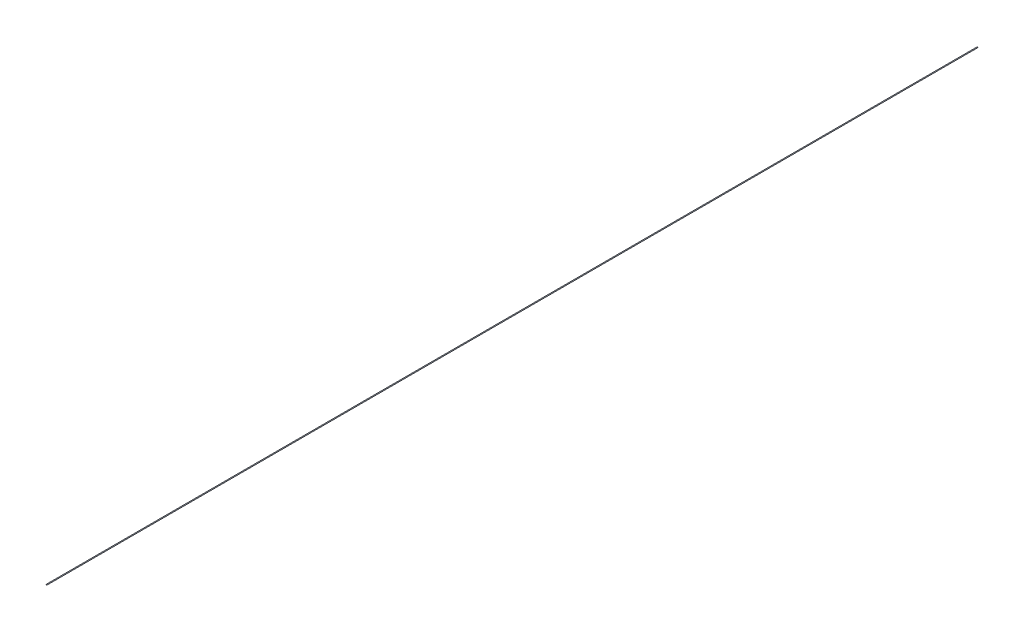
from build123d import *

# Parameters (mm, degrees)
SKETCH1_R      = 3.175
EXTRUDE1_DEPTH = 7620


with BuildPart() as part:
    # Sketch1 → Extrude1 (new body)
    with BuildSketch(Plane.XY):
        Circle(SKETCH1_R)
    extrude(amount=EXTRUDE1_DEPTH)


solid = part.part
